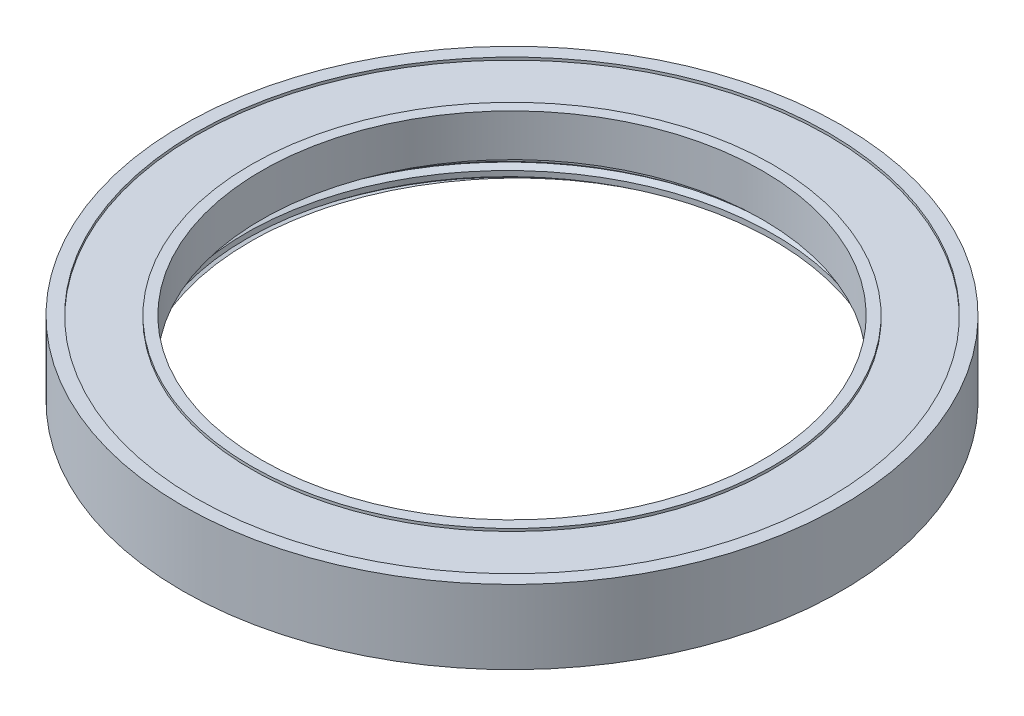
from build123d import *

# Parameters (mm, degrees)
THREAD1_PITCH           = 2.5
THREAD2_PITCH           = 2.5
SKETCH3_W               = 15
SKETCH3_H               = 10
CUT_EXTRUDE1_DEPTH      = 96.495209461
CUT_EXTRUDE2_DEPTH      = 96.495209461
CUT_EXTRUDE2_DEPTH_BACK = 96.495209461
SKETCH4_W               = 125
SKETCH4_H               = 20.019774924


with BuildPart() as part:
    # Sketch2 → Revolve1 (revolve)
    with BuildSketch(Plane(origin=(0, 0, 0), x_dir=(0, 0, -1), z_dir=(1, 0, 0))):
        Polygon((49.5, 36.15), (47.5, 36.15), (47.5, 12.15), (50, 12.15), (50, 6.65), (60, 6.65), (60, 6.15), (62.5, 6.15), (62.5, 20.15), (60, 20.15), (60, 19.65), (49.5, 19.65), align=None)
    revolve(axis=Axis((0, 0, 0), (0, 1, 0)))

    # Thread1: arcs per turn and ends read off the stored shape
    # Thread1: the profile of Thread Profile1 profile screwed along a right-hand helix through 2.4 turns, 10 arcs to a turn; built about Z, then put on its axis
    thread1_z = Axis((0, 0, 0), (0, 0, 1))
    thread1_corners = [(-40.450607014, -29.389086279, -6.000173205), (-41.326636301, -30.025558812, -5.375000003), (-41.326636301, -30.025558812, -5.125000003), (-40.450607014, -29.389086279, -4.4998268)]
    with BuildLine(mode=Mode.PRIVATE) as thread1_profile:
        Line(thread1_corners[0], thread1_corners[1])
        Line(thread1_corners[1], thread1_corners[2])
        Line(thread1_corners[2], thread1_corners[3])
        Line(thread1_corners[3], thread1_corners[0])
    thread1_cap = Face(thread1_profile.wire())
    thread1_turn_angles = [0, 18, 36, 54, 72, 90, 108, 126, 144, 162, 180, 198, 216, 234, 252, 270, 288, 306, 324, 342, 360]
    thread1_turn_weights = [1, 0.9510565162951535, 1, 0.9510565162951535, 1, 0.9510565162951535, 1, 0.9510565162951535, 1, 0.9510565162951535, 1, 0.9510565162951535, 1, 0.9510565162951535, 1, 0.9510565162951535, 1, 0.9510565162951535, 1, 0.9510565162951535, 1]
    thread1_turn_rails = [Edge.make_bspline([Vector(p[0], p[1], 0).rotate(thread1_z, thread1_turn_angles[k]) / thread1_turn_weights[k] + Vector(0, 0, p[2] + THREAD1_PITCH * thread1_turn_angles[k] / 360) for k in range(21)], [0, 0, 0, 1, 1, 2, 2, 3, 3, 4, 4, 5, 5, 6, 6, 7, 7, 8, 8, 9, 9, 10, 10, 10], 2, thread1_turn_weights) for p in thread1_corners]
    thread1_turn_sides = [Face.make_surface_from_curves(thread1_turn_rails[p[0]], thread1_turn_rails[p[1]]) for p in [(0, 1), (1, 2), (2, 3), (3, 0)]]
    thread1_last_angles = [720, 738, 756, 774, 792, 810, 828, 846, 864]
    thread1_last_weights = [1, 0.9510565162951535, 1, 0.9510565162951535, 1, 0.9510565162951535, 1, 0.9510565162951535, 1]
    thread1_last_rails = [Edge.make_bspline([Vector(p[0], p[1], 0).rotate(thread1_z, thread1_last_angles[k]) / thread1_last_weights[k] + Vector(0, 0, p[2] + THREAD1_PITCH * thread1_last_angles[k] / 360) for k in range(9)], [0, 0, 0, 1, 1, 2, 2, 3, 3, 4, 4, 4], 2, thread1_last_weights) for p in thread1_corners]
    thread1_last_sides = [Face.make_surface_from_curves(thread1_last_rails[p[0]], thread1_last_rails[p[1]]) for p in [(0, 1), (1, 2), (2, 3), (3, 0)]]
    thread1 = Plane(origin=(0, 6.65, 0), x_dir=(1, 0, 0), z_dir=(0, -1, 0)) * Solid(Shell([*[p.moved(Location((0, 0, THREAD1_PITCH * i))) for i in range(2) for p in thread1_turn_sides], *thread1_last_sides, thread1_cap, thread1_cap.rotate(thread1_z, 864).moved(Location((0, 0, THREAD1_PITCH * 864 / 360)))]))
    add(thread1, mode=Mode.SUBTRACT)

    # Thread2: arcs per turn and ends read off the stored shape
    # Thread2: the profile of Thread Profile2 profile screwed along a right-hand helix through 1.6 turns, 10 arcs to a turn; built about Z, then put on its axis
    thread2_z = Axis((0, 0, 0), (0, 0, 1))
    thread2_corners = [(49.4997, 0, -0.000173205), (50.58253175, 0, 0.624999997), (50.58253175, 0, 0.874999997), (49.4997, 0, 1.5001732)]
    with BuildLine(mode=Mode.PRIVATE) as thread2_profile:
        Line(thread2_corners[0], thread2_corners[1])
        Line(thread2_corners[1], thread2_corners[2])
        Line(thread2_corners[2], thread2_corners[3])
        Line(thread2_corners[3], thread2_corners[0])
    thread2_cap = Face(thread2_profile.wire())
    thread2_turn_angles = [0, 18, 36, 54, 72, 90, 108, 126, 144, 162, 180, 198, 216, 234, 252, 270, 288, 306, 324, 342, 360]
    thread2_turn_weights = [1, 0.9510565162951535, 1, 0.9510565162951535, 1, 0.9510565162951535, 1, 0.9510565162951535, 1, 0.9510565162951535, 1, 0.9510565162951535, 1, 0.9510565162951535, 1, 0.9510565162951535, 1, 0.9510565162951535, 1, 0.9510565162951535, 1]
    thread2_turn_rails = [Edge.make_bspline([Vector(p[0], p[1], 0).rotate(thread2_z, thread2_turn_angles[k]) / thread2_turn_weights[k] + Vector(0, 0, p[2] + THREAD2_PITCH * thread2_turn_angles[k] / 360) for k in range(21)], [0, 0, 0, 1, 1, 2, 2, 3, 3, 4, 4, 5, 5, 6, 6, 7, 7, 8, 8, 9, 9, 10, 10, 10], 2, thread2_turn_weights) for p in thread2_corners]
    thread2_turn_sides = [Face.make_surface_from_curves(thread2_turn_rails[p[0]], thread2_turn_rails[p[1]]) for p in [(0, 1), (1, 2), (2, 3), (3, 0)]]
    thread2_last_angles = [360, 378, 396, 414, 432, 450, 468, 486, 504, 522, 540, 558, 576]
    thread2_last_weights = [1, 0.9510565162951535, 1, 0.9510565162951535, 1, 0.9510565162951535, 1, 0.9510565162951535, 1, 0.9510565162951535, 1, 0.9510565162951535, 1]
    thread2_last_rails = [Edge.make_bspline([Vector(p[0], p[1], 0).rotate(thread2_z, thread2_last_angles[k]) / thread2_last_weights[k] + Vector(0, 0, p[2] + THREAD2_PITCH * thread2_last_angles[k] / 360) for k in range(13)], [0, 0, 0, 1, 1, 2, 2, 3, 3, 4, 4, 5, 5, 6, 6, 6], 2, thread2_last_weights) for p in thread2_corners]
    thread2_last_sides = [Face.make_surface_from_curves(thread2_last_rails[p[0]], thread2_last_rails[p[1]]) for p in [(0, 1), (1, 2), (2, 3), (3, 0)]]
    thread2 = Plane(origin=(0, 36.15, 0), x_dir=(-1, 0, 0), z_dir=(0, -1, 0)) * Solid(Shell([*thread2_turn_sides, *thread2_last_sides, thread2_cap, thread2_cap.rotate(thread2_z, 576).moved(Location((0, 0, THREAD2_PITCH * 576 / 360)))]))
    add(thread2)

    # Sketch3 → Cut-Extrude1 (cut, through all)
    with BuildSketch(Plane.XY):
        with Locations((0, 25.587500003)):
            Rectangle(SKETCH3_W, SKETCH3_H)
    extrude(amount=-CUT_EXTRUDE1_DEPTH, mode=Mode.SUBTRACT)

    # Sketch4 → Cut-Extrude2 (cut, two sides: drawn at the far end of the back side and taken through both)
    with BuildSketch(Plane(origin=(0, 0, 0), x_dir=(0, 0, -1), z_dir=(1, 0, 0)).offset(-CUT_EXTRUDE2_DEPTH_BACK)):
        with Locations((0, 30.159887462)):
            Rectangle(SKETCH4_W, SKETCH4_H)
    extrude(amount=CUT_EXTRUDE2_DEPTH + CUT_EXTRUDE2_DEPTH_BACK, mode=Mode.SUBTRACT)


solid = part.part
